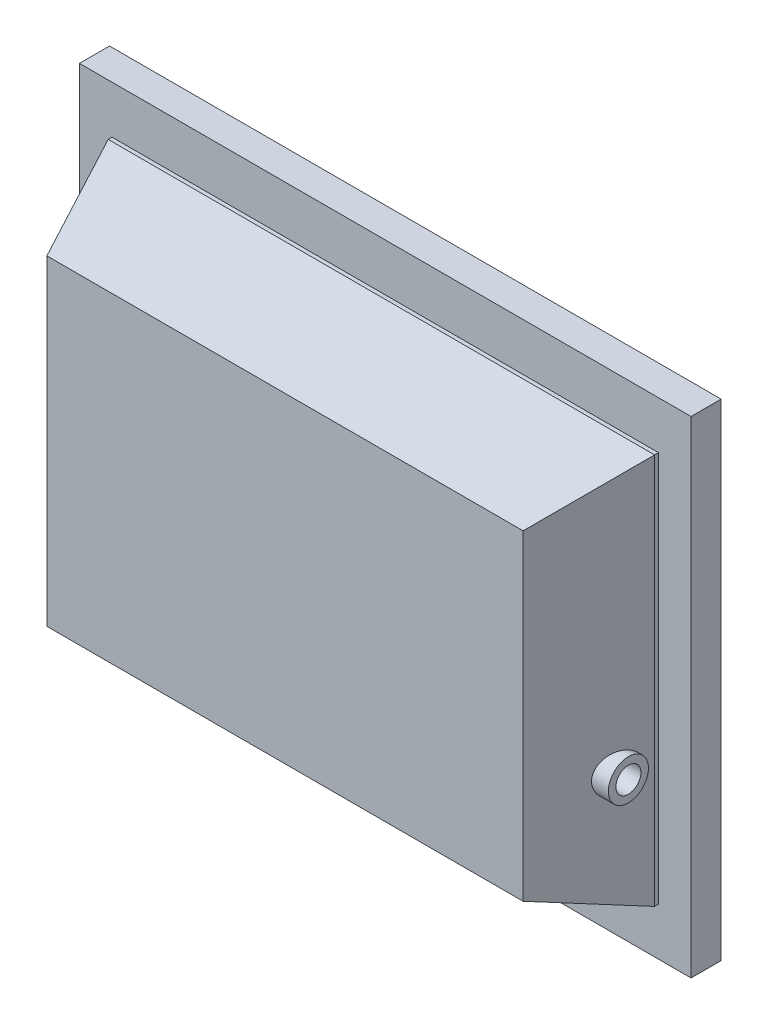
from build123d import *

# Parameters (mm, degrees)
SKIZZE1_W                       = 122
SKIZZE1_H                       = 97
AUFSATZ_LINEAR_AUSTRAGEN1_DEPTH = 6
SKIZZE2_W                       = 109
SKIZZE2_H                       = 78
AUFSATZ_LINEAR_AUSTRAGEN2_DEPTH = 20
SCHNITT_LINEAR_AUSTRAGEN1_REACH = 129.939
SKIZZE3_R                       = 2.5
FASE1_SIZE                      = 19.232341936
FASE1_SIZE_2                    = 7
AUFSATZ_LINEAR_AUSTRAGEN3_REACH = 129.939
SKIZZE4_R                       = 4
SKIZZE4_R_2                     = 2.5
SKIZZE5_W                       = 92.481860848
SKIZZE5_H                       = 69.364192104
SCHNITT_LINEAR_AUSTRAGEN2_DEPTH = 1


with BuildPart() as part:
    # Skizze1 → Aufsatz-Linear austragen1 (new body)
    with BuildSketch(Plane.XY):
        Rectangle(SKIZZE1_W, SKIZZE1_H)
    extrude(amount=AUFSATZ_LINEAR_AUSTRAGEN1_DEPTH)

    # Skizze2 → Aufsatz-Linear austragen2 (add)
    with BuildSketch(Plane.XY.offset(6)):
        Rectangle(SKIZZE2_W, SKIZZE2_H)
    extrude(amount=AUFSATZ_LINEAR_AUSTRAGEN2_DEPTH)

    # Skizze3 → Schnitt-Linear austragen1 (cut, up to next)
    with BuildSketch(Plane(origin=(54.5, 0, 0), x_dir=(0, 0, -1), z_dir=(1, 0, 0)), mode=Mode.PRIVATE) as schnitt_linear_austragen1_sk1:
        with Locations((-12, -14.5)):
            Circle(SKIZZE3_R)
    schnitt_linear_austragen1_tool1 = extrude(schnitt_linear_austragen1_sk1.sketch, amount=-SCHNITT_LINEAR_AUSTRAGEN1_REACH, mode=Mode.PRIVATE) & part.part
    add(schnitt_linear_austragen1_tool1.solids().sort_by_distance((54.5, -14.5, 12))[0], mode=Mode.SUBTRACT)

    # Fase1
    # the kernel refuses this chamfer: 19.232341936, 7 mm, written as the material it takes off along each edge
    with BuildSketch(Plane(origin=(54.5, -88.892440145, 26), x_dir=(0.013184058198645607, 0, -0.9999130865277316), z_dir=(0, 1, 0)), Plane(origin=(-54.5, 88.892440145, 26), x_dir=(-0.013184058198645607, 0, -0.9999130865277316), z_dir=(0, -1, 0))) as fase1_piece_1:
        Polygon((FASE1_SIZE * 0.999913086537, FASE1_SIZE * 0.0131840581988), (-FASE1_SIZE_2 * 0.0131840581986, FASE1_SIZE_2 * 0.999913086528), (0, 0), align=None)
    extrude(amount=177.784880291, mode=Mode.SUBTRACT)
    with BuildSketch(Plane(origin=(104.392440145, 39, 26), x_dir=(0, 0.013184058198645607, -0.9999130865277316), z_dir=(-1, 0, 0)), Plane(origin=(-104.392440145, -39, 26), x_dir=(0, -0.013184058198645607, -0.9999130865277316), z_dir=(1, 0, 0))) as fase1_piece_2:
        Polygon((FASE1_SIZE * 0.999913086537, FASE1_SIZE * 0.0131840581988), (-FASE1_SIZE_2 * 0.0131840581986, FASE1_SIZE_2 * 0.999913086528), (0, 0), align=None)
    extrude(amount=208.784880291, mode=Mode.SUBTRACT)

    # Aufsatz-Linear austragen3: up to this face of the body (flat: up to its plane)
    aufsatz_linear_austragen3_end = Plane(part.part.faces().sort_by_distance((-54.5, 0, 6.383829032))[0])
    # Skizze4 → Aufsatz-Linear austragen3 (add, up to the picked face)
    with BuildSketch(Plane(origin=(54.5, 0, 0), x_dir=(0, 0, -1), z_dir=(1, 0, 0)), mode=Mode.PRIVATE) as aufsatz_linear_austragen3_sk1:
        with Locations((-12, -14.5)):
            Circle(SKIZZE4_R)
        with Locations((-12, -14.5)):
            Circle(SKIZZE4_R_2, mode=Mode.SUBTRACT)
    aufsatz_linear_austragen3_tool1 = split(extrude(aufsatz_linear_austragen3_sk1.sketch, amount=-AUFSATZ_LINEAR_AUSTRAGEN3_REACH, mode=Mode.PRIVATE), bisect_by=aufsatz_linear_austragen3_end, keep=Keep.BOTH, mode=Mode.PRIVATE)
    add(aufsatz_linear_austragen3_tool1.solids().sort_by(Axis((54.5, -14.5, 15.886863), (-1, 0, 0)))[0])

    # Skizze5 → Schnitt-Linear austragen2 (cut)
    with BuildSketch(Plane(origin=(0, 0, 0), x_dir=(-1, 0, 0), z_dir=(0, 0, -1))):
        Rectangle(SKIZZE5_W, SKIZZE5_H)
    extrude(amount=-SCHNITT_LINEAR_AUSTRAGEN2_DEPTH, mode=Mode.SUBTRACT)


solid = part.part
